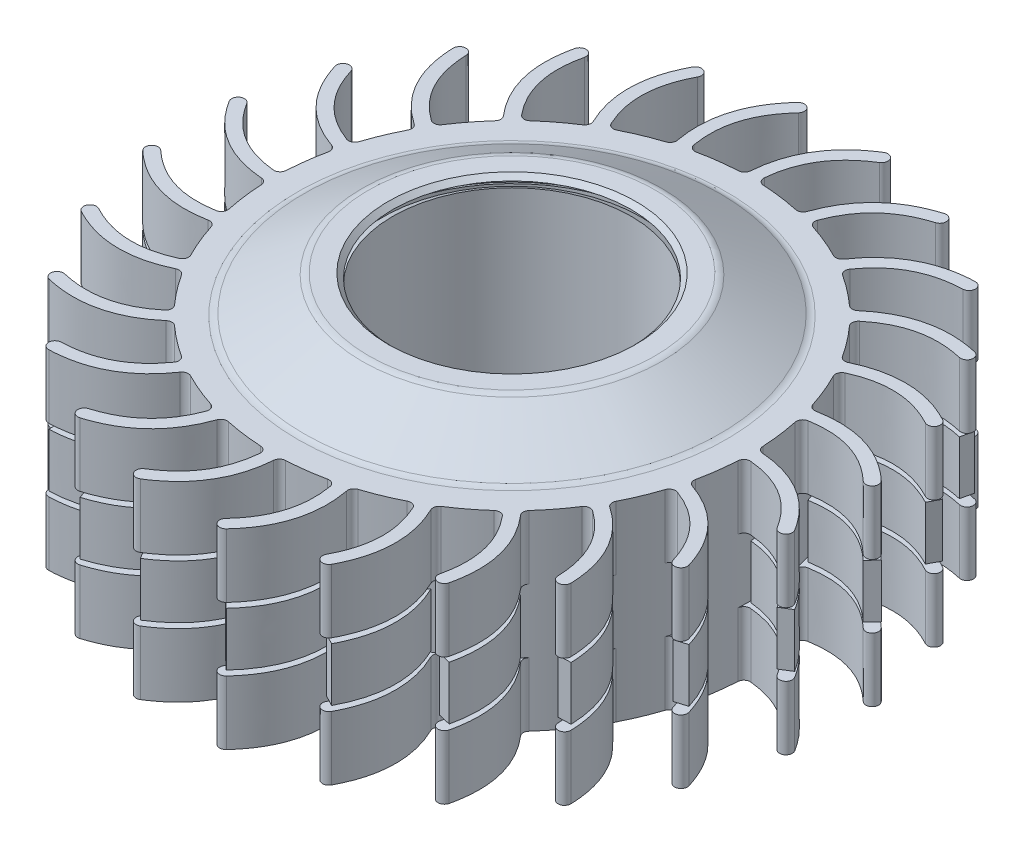
from build123d import *

# Parameters (mm, degrees)
SKETCH1_R                = 18.75
SKETCH1_R_2              = 13.75
BOSS_EXTRUDE1_DEPTH      = 15
BOSS_EXTRUDE2_DEPTH      = 5
FILLET1_R                = 0.5
FILLET2_DEPTH            = 5
CIRPATTERN1_COUNT        = 24
FILLET1_OF_CIRPATTERN1_R = 0.5
MIRROR1_START            = 10
MIRROR1_DEPTH            = 5
FILLET4_R                = 1
CHAMFER1_SIZE            = 1
CHAMFER1_SIZE_2          = 0.732050808
BOSS_EXTRUDE3_DEPTH      = 4.2
CIRPATTERN4_COUNT        = 24
BOSS_EXTRUDE4_REACH      = 42.713
SKETCH6_R                = 12.317160209
SKETCH6_R_2              = 11.517160209
SKETCH6_R_3              = 10.154712578
SKETCH6_R_4              = 9.354712578


with BuildPart() as part:
    # Sketch1 → Boss-Extrude1 (new body)
    with BuildSketch(Plane(origin=(0, 0, 0), x_dir=(1, 0, 0), z_dir=(0, 1, 0))):
        with Locations(Location((0, 0, 0), (0, 0, 270))):
            Circle(SKETCH1_R)
        with Locations(Location((0, 0, 0), (0, 0, 270))):
            Circle(SKETCH1_R_2, mode=Mode.SUBTRACT)
    extrude(amount=BOSS_EXTRUDE1_DEPTH)

    # Sketch2 → Boss-Extrude2 (add)
    with BuildSketch(Plane(origin=(0, 0, 0), x_dir=(1, 0, 0), z_dir=(0, 1, 0))):
        with BuildLine():
            ThreePointArc((18.75, 0), (18.74833243, -0.250062213), (18.743330015, -0.500079947))
            add(Edge.make_bspline(
                [(18.743330015, -0.500079947), (20.249175085, -0.554696371), (22.276517283, -1.391892892), (24.018730993, -2.731723154), (24.82083161, -4.014422972)],
                knots=[0.001258871, 0.001258871, 0.001258871, 0.375, 0.625, 1, 1, 1], degree=2))
            ThreePointArc((24.82083161, -4.014422972), (25.509613501, -4.174358919), (25.669549447, -3.485577028))
            add(Edge.make_bspline(
                [(18.766817552, 0.49971709), (20.440613064, 0.445794798), (22.781173245, -0.517803125), (24.785953616, -2.06298874), (25.669549447, -3.485577028)],
                knots=[0, 0, 0, 0.375, 0.625, 1, 1, 1], degree=2))
            Line((18.766817552, 0.49971709), (18.743339693, 0.49971709))
            ThreePointArc((18.743339693, 0.49971709), (18.748334849, 0.249880736), (18.75, 0))
        make_face()
    boss_extrude2 = extrude(amount=BOSS_EXTRUDE2_DEPTH)

    # Fillet1
    fillet1_edges = [part.edges().sort_by_distance(p)[0] for p in [
        (18.743330015, 2.5, 0.500079947),
    ]]
    fillet(fillet1_edges, radius=FILLET1_R)

    # Fillet2: read off the stored shape, not the designer's step
    # Fillet2 outline → Fillet2 (add)
    with BuildSketch(Plane(origin=(0, 0, 0), x_dir=(1, 0, 0), z_dir=(0, 1, 0))):
        with BuildLine():
            add(Edge.make_bspline(
                [(18.766817552, 0.49971709), (18.979861137, 0.492853767), (19.188539307, 0.47749748)],
                knots=[0, 0, 0, 0.047730648, 0.047730648, 0.047730648], degree=2))
            ThreePointArc((19.188539307, 0.47749748), (18.867686512, 0.626635767), (18.725877539, 0.950794618))
            ThreePointArc((18.725877539, 0.950794618), (18.735966154, 0.725308407), (18.743339693, 0.49971709))
            Line((18.743339693, 0.49971709), (18.766817552, 0.49971709))
        make_face()
    fillet2 = extrude(amount=FILLET2_DEPTH)

    # CirPattern1: Boss-Extrude2, Fillet2 ×24 about axis
    cirpattern1_axis = Axis((0, 15, 0), (0, 1, 0))
    add([boss_extrude2.rotate(cirpattern1_axis, i * 360 / CIRPATTERN1_COUNT) for i in range(1, CIRPATTERN1_COUNT)])
    add([fillet2.rotate(cirpattern1_axis, i * 360 / CIRPATTERN1_COUNT) for i in range(1, CIRPATTERN1_COUNT)])

    # Fillet1 of CirPattern1
    fillet1_of_cirpattern1_edges = [part.edges().sort_by_distance(p)[0] for p in [
        (18.234096746, 2.5, -4.368090641),
        (16.482239918, 2.5, -8.93858307),
        (13.607145677, 2.5, -12.899925834),
        (9.804746945, 2.5, -15.982159971),
        (5.334170912, 2.5, -17.975236318),
        (0.500079947, 2.5, -18.743330015),
        (-4.368090641, 2.5, -18.234096746),
        (-8.93858307, 2.5, -16.482239918),
        (-12.899925834, 2.5, -13.607145677),
        (-15.982159971, 2.5, -9.804746945),
        (-17.975236318, 2.5, -5.334170912),
        (-18.743330015, 2.5, -0.500079947),
        (-18.234096746, 2.5, 4.368090641),
        (-16.482239918, 2.5, 8.93858307),
        (-13.607145677, 2.5, 12.899925834),
        (-9.804746945, 2.5, 15.982159971),
        (-5.334170912, 2.5, 17.975236318),
        (-0.500079947, 2.5, 18.743330015),
        (4.368090641, 2.5, 18.234096746),
        (8.93858307, 2.5, 16.482239918),
        (12.899925834, 2.5, 13.607145677),
        (15.982159971, 2.5, 9.804746945),
        (17.975236318, 2.5, 5.334170912),
    ]]
    fillet(fillet1_of_cirpattern1_edges, radius=FILLET1_OF_CIRPATTERN1_R)

    # Mirror1: read off the stored shape, not the designer's step
    # Mirror1 outline → Mirror1 (add)
    with BuildSketch(Plane(origin=(0, 0, 0), x_dir=(1, 0, 0), z_dir=(0, 1, 0)).offset(MIRROR1_START)):
        with BuildLine():
            ThreePointArc((18.723067695, -1.004607436), (18.895412165, -0.653095529), (19.268186532, -0.533502434))
            add(Edge.make_bspline(
                [(19.268186532, -0.533502434), (20.464567735, -0.643643356), (22.276517283, -1.391892892), (24.018730993, -2.731723154), (24.82083161, -4.014422972)],
                knots=[0.067527533, 0.067527533, 0.067527533, 0.375, 0.625, 1, 1, 1], degree=2))
            ThreePointArc((24.82083161, -4.014422972), (25.509613501, -4.174358919), (25.669549447, -3.485577028))
            add(Edge.make_bspline(
                [(19.188539307, 0.47749748), (20.61935939, 0.372205753), (22.781173245, -0.517803125), (24.785953616, -2.06298874), (25.669549447, -3.485577028)],
                knots=[0.047730648, 0.047730648, 0.047730648, 0.375, 0.625, 1, 1, 1], degree=2))
            ThreePointArc((19.188539307, 0.47749748), (18.867686512, 0.626635767), (18.725877539, 0.950794618))
            ThreePointArc((18.725877539, 0.950794618), (18.749980642, -0.026943063), (18.723067695, -1.004607436))
        make_face()
        with BuildLine():
            ThreePointArc((18.658291127, -4.505132273), (18.386970955, -4.278032935), (18.33389249, -3.928216666))
            ThreePointArc((18.33389249, -3.928216666), (18.104117167, -4.878877086), (17.825083096, -5.81626277))
            ThreePointArc((17.825083096, -5.81626277), (18.082533046, -5.521334371), (18.473558406, -5.502297418))
            add(Edge.make_bspline(
                [(18.473558406, -5.502297418), (19.60066734, -5.91833162), (21.157214974, -7.110052223), (22.493290602, -8.855146965), (22.936073162, -10.301738762)],
                knots=[0.067527533, 0.067527533, 0.067527533, 0.375, 0.625, 1, 1, 1], degree=2))
            ThreePointArc((22.936073162, -10.301738762), (23.55999091, -10.634494895), (23.892747042, -10.010577147))
            add(Edge.make_bspline(
                [(18.658291127, -4.505132273), (20.013105694, -4.977159759), (21.87090628, -6.396360917), (23.407451951, -8.40777095), (23.892747042, -10.010577147)],
                knots=[0.047730648, 0.047730648, 0.047730648, 0.375, 0.625, 1, 1, 1], degree=2))
        make_face()
        with BuildLine():
            ThreePointArc((16.856511241, -9.180744706), (16.653213713, -8.891160762), (16.692482966, -8.539526476))
            ThreePointArc((16.692482966, -8.539526476), (16.224488025, -9.398323698), (15.712348542, -10.231549408))
            ThreePointArc((15.712348542, -10.231549408), (16.037359185, -10.013303401), (16.419987804, -10.096119927))
            add(Edge.make_bspline(
                [(16.419987804, -10.096119927), (17.401013857, -10.789695365), (18.596083429, -12.343673245), (19.434969629, -14.375107144), (19.488259231, -15.88700808)],
                knots=[0.067527533, 0.067527533, 0.067527533, 0.375, 0.625, 1, 1, 1], degree=2))
            ThreePointArc((19.488259231, -15.88700808), (20.004793873, -16.369907618), (20.487693411, -15.853372976))
            add(Edge.make_bspline(
                [(16.856511241, -9.180744706), (18.042991918, -9.987340058), (19.470173196, -11.839017283), (20.433771119, -14.179577464), (20.487693411, -15.853372976)],
                knots=[0.047730648, 0.047730648, 0.047730648, 0.375, 0.625, 1, 1, 1], degree=2))
        make_face()
        with BuildLine():
            ThreePointArc((17.841724979, 5.76501082), (18.118063922, 4.826827085), (18.345106171, 3.875510235))
            ThreePointArc((18.345106171, 3.875510235), (18.420600169, 4.259650695), (18.749719587, 4.47164986))
            add(Edge.make_bspline(
                [(18.749719587, 4.47164986), (19.933841658, 4.674908139), (21.877711753, 4.42112164), (23.907334559, 3.577863075), (25.014091402, 2.546469109)],
                knots=[0.067527533, 0.067527533, 0.067527533, 0.375, 0.625, 1, 1, 1], degree=2))
            ThreePointArc((25.014091402, 2.546469109), (25.720798088, 2.570252719), (25.697014478, 3.276959405))
            add(Edge.make_bspline(
                [(18.411120244, 5.427586568), (19.820437819, 5.696206057), (22.138940901, 5.396042094), (24.475333503, 4.422382744), (25.697014478, 3.276959405)],
                knots=[0.047730648, 0.047730648, 0.047730648, 0.375, 0.625, 1, 1, 1], degree=2))
            ThreePointArc((18.411120244, 5.427586568), (18.062600413, 5.488600278), (17.841724979, 5.76501082))
        make_face()
        with BuildLine():
            ThreePointArc((13.905987971, -13.230704559), (13.784567478, -12.898370677), (13.913508313, -12.568881669))
            ThreePointArc((13.913508313, -12.568881669), (13.239186836, -13.277290082), (12.528843401, -13.949572862))
            ThreePointArc((12.528843401, -13.949572862), (12.899265798, -13.822882352), (13.247422169, -14.001908547))
            add(Edge.make_bspline(
                [(13.247422169, -14.001908547), (14.015510037, -14.925759201), (14.76765953, -16.736093335), (15.052187594, -18.915427527), (14.71235264, -20.389604052)],
                knots=[0.067527533, 0.067527533, 0.067527533, 0.375, 0.625, 1, 1, 1], degree=2))
            ThreePointArc((14.71235264, -20.389604052), (15.086303193, -20.98973819), (15.686437331, -20.615787637))
            add(Edge.make_bspline(
                [(13.905987971, -13.230704559), (14.84327806, -14.316899637), (15.742579984, -16.474864186), (16.067562553, -18.985069208), (15.686437331, -20.615787637)],
                knots=[0.047730648, 0.047730648, 0.047730648, 0.375, 0.625, 1, 1, 1], degree=2))
        make_face()
        with BuildLine():
            ThreePointArc((15.741688348, 10.186351062), (16.251431088, 9.351656944), (16.716955978, 8.491518287))
            ThreePointArc((16.716955978, 8.491518287), (16.690454714, 8.882108763), (16.953490238, 9.172066605))
            add(Edge.make_bspline(
                [(16.953490238, 9.172066605), (18.044657214, 9.67487237), (19.987976321, 9.932844038), (22.166692783, 9.643623848), (23.502682203, 8.933823529)],
                knots=[0.067527533, 0.067527533, 0.067527533, 0.375, 0.625, 1, 1, 1], degree=2))
            ThreePointArc((23.502682203, 8.933823529), (24.179152792, 9.139705882), (23.973270439, 9.816176471))
            add(Edge.make_bspline(
                [(16.379013761, 10.007794601), (17.670786165, 10.632019332), (19.987976321, 10.942155962), (22.496759858, 10.606376152), (23.973270439, 9.816176471)],
                knots=[0.047730648, 0.047730648, 0.047730648, 0.375, 0.625, 1, 1, 1], degree=2))
            ThreePointArc((16.379013761, 10.007794601), (16.026577946, 9.976525749), (15.741688348, 10.186351062))
        make_face()
        with BuildLine():
            ThreePointArc((10.007794601, -16.379013761), (9.976525749, -16.026577946), (10.186351062, -15.741688348))
            ThreePointArc((10.186351062, -15.741688348), (9.351656944, -16.251431088), (8.491518287, -16.716955978))
            ThreePointArc((8.491518287, -16.716955978), (8.882108763, -16.690454714), (9.172066605, -16.953490238))
            add(Edge.make_bspline(
                [(9.172066605, -16.953490238), (9.67487237, -18.044657214), (9.932844038, -19.987976321), (9.643623848, -22.166692783), (8.933823529, -23.502682203)],
                knots=[0.067527533, 0.067527533, 0.067527533, 0.375, 0.625, 1, 1, 1], degree=2))
            ThreePointArc((8.933823529, -23.502682203), (9.139705882, -24.179152792), (9.816176471, -23.973270439))
            add(Edge.make_bspline(
                [(10.007794601, -16.379013761), (10.632019332, -17.670786165), (10.942155962, -19.987976321), (10.606376152, -22.496759858), (9.816176471, -23.973270439)],
                knots=[0.047730648, 0.047730648, 0.047730648, 0.375, 0.625, 1, 1, 1], degree=2))
        make_face()
        with BuildLine():
            ThreePointArc((12.568881669, 13.913508313), (13.277290082, 13.239186836), (13.949572862, 12.528843401))
            ThreePointArc((13.949572862, 12.528843401), (13.822882352, 12.899265798), (14.001908547, 13.247422169))
            add(Edge.make_bspline(
                [(14.001908547, 13.247422169), (14.925759201, 14.015510037), (16.736093335, 14.76765953), (18.915427527, 15.052187594), (20.389604052, 14.71235264)],
                knots=[0.067527533, 0.067527533, 0.067527533, 0.375, 0.625, 1, 1, 1], degree=2))
            ThreePointArc((20.389604052, 14.71235264), (20.98973819, 15.086303193), (20.615787637, 15.686437331))
            add(Edge.make_bspline(
                [(13.230704559, 13.905987971), (14.316899637, 14.84327806), (16.474864186, 15.742579984), (18.985069208, 16.067562553), (20.615787637, 15.686437331)],
                knots=[0.047730648, 0.047730648, 0.047730648, 0.375, 0.625, 1, 1, 1], degree=2))
            ThreePointArc((13.230704559, 13.905987971), (12.898370677, 13.784567478), (12.568881669, 13.913508313))
        make_face()
        with BuildLine():
            ThreePointArc((5.427586568, -18.411120244), (5.488600278, -18.062600413), (5.76501082, -17.841724979))
            ThreePointArc((5.76501082, -17.841724979), (4.826827085, -18.118063922), (3.875510235, -18.345106171))
            ThreePointArc((3.875510235, -18.345106171), (4.259650695, -18.420600169), (4.47164986, -18.749719587))
            add(Edge.make_bspline(
                [(4.47164986, -18.749719587), (4.674908139, -19.933841658), (4.42112164, -21.877711753), (3.577863075, -23.907334559), (2.546469109, -25.014091402)],
                knots=[0.067527533, 0.067527533, 0.067527533, 0.375, 0.625, 1, 1, 1], degree=2))
            ThreePointArc((2.546469109, -25.014091402), (2.570252719, -25.720798088), (3.276959405, -25.697014478))
            add(Edge.make_bspline(
                [(5.427586568, -18.411120244), (5.696206057, -19.820437819), (5.396042094, -22.138940901), (4.422382744, -24.475333503), (3.276959405, -25.697014478)],
                knots=[0.047730648, 0.047730648, 0.047730648, 0.375, 0.625, 1, 1, 1], degree=2))
        make_face()
        with BuildLine():
            ThreePointArc((8.539526476, 16.692482966), (9.398323698, 16.224488025), (10.231549408, 15.712348542))
            ThreePointArc((10.231549408, 15.712348542), (10.013303401, 16.037359185), (10.096119927, 16.419987804))
            add(Edge.make_bspline(
                [(10.096119927, 16.419987804), (10.789695365, 17.401013857), (12.343673245, 18.596083429), (14.375107144, 19.434969629), (15.88700808, 19.488259231)],
                knots=[0.067527533, 0.067527533, 0.067527533, 0.375, 0.625, 1, 1, 1], degree=2))
            ThreePointArc((15.88700808, 19.488259231), (16.369907618, 20.004793873), (15.853372976, 20.487693411))
            add(Edge.make_bspline(
                [(9.180744706, 16.856511241), (9.987340058, 18.042991918), (11.839017283, 19.470173196), (14.179577464, 20.433771119), (15.853372976, 20.487693411)],
                knots=[0.047730648, 0.047730648, 0.047730648, 0.375, 0.625, 1, 1, 1], degree=2))
            ThreePointArc((9.180744706, 16.856511241), (8.891160762, 16.653213713), (8.539526476, 16.692482966))
        make_face()
        with BuildLine():
            ThreePointArc((0.47749748, -19.188539307), (0.626635767, -18.867686512), (0.950794618, -18.725877539))
            ThreePointArc((0.950794618, -18.725877539), (-0.026943063, -18.749980642), (-1.004607436, -18.723067695))
            ThreePointArc((-1.004607436, -18.723067695), (-0.653095529, -18.895412165), (-0.533502434, -19.268186532))
            add(Edge.make_bspline(
                [(-0.533502434, -19.268186532), (-0.643643356, -20.464567735), (-1.391892892, -22.276517283), (-2.731723154, -24.018730993), (-4.014422972, -24.82083161)],
                knots=[0.067527533, 0.067527533, 0.067527533, 0.375, 0.625, 1, 1, 1], degree=2))
            ThreePointArc((-4.014422972, -24.82083161), (-4.174358919, -25.509613501), (-3.485577028, -25.669549447))
            add(Edge.make_bspline(
                [(0.47749748, -19.188539307), (0.372205753, -20.61935939), (-0.517803125, -22.781173245), (-2.06298874, -24.785953616), (-3.485577028, -25.669549447)],
                knots=[0.047730648, 0.047730648, 0.047730648, 0.375, 0.625, 1, 1, 1], degree=2))
        make_face()
        with BuildLine():
            ThreePointArc((3.928216666, 18.33389249), (4.878877086, 18.104117167), (5.81626277, 17.825083096))
            ThreePointArc((5.81626277, 17.825083096), (5.521334371, 18.082533046), (5.502297418, 18.473558406))
            add(Edge.make_bspline(
                [(5.502297418, 18.473558406), (5.91833162, 19.60066734), (7.110052223, 21.157214974), (8.855146965, 22.493290602), (10.301738762, 22.936073162)],
                knots=[0.067527533, 0.067527533, 0.067527533, 0.375, 0.625, 1, 1, 1], degree=2))
            ThreePointArc((10.301738762, 22.936073162), (10.634494895, 23.55999091), (10.010577147, 23.892747042))
            add(Edge.make_bspline(
                [(4.505132273, 18.658291127), (4.977159759, 20.013105694), (6.396360917, 21.87090628), (8.40777095, 23.407451951), (10.010577147, 23.892747042)],
                knots=[0.047730648, 0.047730648, 0.047730648, 0.375, 0.625, 1, 1, 1], degree=2))
            ThreePointArc((4.505132273, 18.658291127), (4.278032935, 18.386970955), (3.928216666, 18.33389249))
        make_face()
        with BuildLine():
            ThreePointArc((-4.505132273, -18.658291127), (-4.278032935, -18.386970955), (-3.928216666, -18.33389249))
            ThreePointArc((-3.928216666, -18.33389249), (-4.878877086, -18.104117167), (-5.81626277, -17.825083096))
            ThreePointArc((-5.81626277, -17.825083096), (-5.521334371, -18.082533046), (-5.502297418, -18.473558406))
            add(Edge.make_bspline(
                [(-5.502297418, -18.473558406), (-5.91833162, -19.60066734), (-7.110052223, -21.157214974), (-8.855146965, -22.493290602), (-10.301738762, -22.936073162)],
                knots=[0.067527533, 0.067527533, 0.067527533, 0.375, 0.625, 1, 1, 1], degree=2))
            ThreePointArc((-10.301738762, -22.936073162), (-10.634494895, -23.55999091), (-10.010577147, -23.892747042))
            add(Edge.make_bspline(
                [(-4.505132273, -18.658291127), (-4.977159759, -20.013105694), (-6.396360917, -21.87090628), (-8.40777095, -23.407451951), (-10.010577147, -23.892747042)],
                knots=[0.047730648, 0.047730648, 0.047730648, 0.375, 0.625, 1, 1, 1], degree=2))
        make_face()
        with BuildLine():
            ThreePointArc((-0.950794618, 18.725877539), (0.026943063, 18.749980642), (1.004607436, 18.723067695))
            ThreePointArc((1.004607436, 18.723067695), (0.653095529, 18.895412165), (0.533502434, 19.268186532))
            add(Edge.make_bspline(
                [(0.533502434, 19.268186532), (0.643643356, 20.464567735), (1.391892892, 22.276517283), (2.731723154, 24.018730993), (4.014422972, 24.82083161)],
                knots=[0.067527533, 0.067527533, 0.067527533, 0.375, 0.625, 1, 1, 1], degree=2))
            ThreePointArc((4.014422972, 24.82083161), (4.174358919, 25.509613501), (3.485577028, 25.669549447))
            add(Edge.make_bspline(
                [(-0.47749748, 19.188539307), (-0.372205753, 20.61935939), (0.517803125, 22.781173245), (2.06298874, 24.785953616), (3.485577028, 25.669549447)],
                knots=[0.047730648, 0.047730648, 0.047730648, 0.375, 0.625, 1, 1, 1], degree=2))
            ThreePointArc((-0.47749748, 19.188539307), (-0.626635767, 18.867686512), (-0.950794618, 18.725877539))
        make_face()
        with BuildLine():
            ThreePointArc((-9.180744706, -16.856511241), (-8.891160762, -16.653213713), (-8.539526476, -16.692482966))
            ThreePointArc((-8.539526476, -16.692482966), (-9.398323698, -16.224488025), (-10.231549408, -15.712348542))
            ThreePointArc((-10.231549408, -15.712348542), (-10.013303401, -16.037359185), (-10.096119927, -16.419987804))
            add(Edge.make_bspline(
                [(-10.096119927, -16.419987804), (-10.789695365, -17.401013857), (-12.343673245, -18.596083429), (-14.375107144, -19.434969629), (-15.88700808, -19.488259231)],
                knots=[0.067527533, 0.067527533, 0.067527533, 0.375, 0.625, 1, 1, 1], degree=2))
            ThreePointArc((-15.88700808, -19.488259231), (-16.369907618, -20.004793873), (-15.853372976, -20.487693411))
            add(Edge.make_bspline(
                [(-9.180744706, -16.856511241), (-9.987340058, -18.042991918), (-11.839017283, -19.470173196), (-14.179577464, -20.433771119), (-15.853372976, -20.487693411)],
                knots=[0.047730648, 0.047730648, 0.047730648, 0.375, 0.625, 1, 1, 1], degree=2))
        make_face()
        with BuildLine():
            ThreePointArc((-5.76501082, 17.841724979), (-4.826827085, 18.118063922), (-3.875510235, 18.345106171))
            ThreePointArc((-3.875510235, 18.345106171), (-4.259650695, 18.420600169), (-4.47164986, 18.749719587))
            add(Edge.make_bspline(
                [(-4.47164986, 18.749719587), (-4.674908139, 19.933841658), (-4.42112164, 21.877711753), (-3.577863075, 23.907334559), (-2.546469109, 25.014091402)],
                knots=[0.067527533, 0.067527533, 0.067527533, 0.375, 0.625, 1, 1, 1], degree=2))
            ThreePointArc((-2.546469109, 25.014091402), (-2.570252719, 25.720798088), (-3.276959405, 25.697014478))
            add(Edge.make_bspline(
                [(-5.427586568, 18.411120244), (-5.696206057, 19.820437819), (-5.396042094, 22.138940901), (-4.422382744, 24.475333503), (-3.276959405, 25.697014478)],
                knots=[0.047730648, 0.047730648, 0.047730648, 0.375, 0.625, 1, 1, 1], degree=2))
            ThreePointArc((-5.427586568, 18.411120244), (-5.488600278, 18.062600413), (-5.76501082, 17.841724979))
        make_face()
        with BuildLine():
            ThreePointArc((-13.230704559, -13.905987971), (-12.898370677, -13.784567478), (-12.568881669, -13.913508313))
            ThreePointArc((-12.568881669, -13.913508313), (-13.277290082, -13.239186836), (-13.949572862, -12.528843401))
            ThreePointArc((-13.949572862, -12.528843401), (-13.822882352, -12.899265798), (-14.001908547, -13.247422169))
            add(Edge.make_bspline(
                [(-14.001908547, -13.247422169), (-14.925759201, -14.015510037), (-16.736093335, -14.76765953), (-18.915427527, -15.052187594), (-20.389604052, -14.71235264)],
                knots=[0.067527533, 0.067527533, 0.067527533, 0.375, 0.625, 1, 1, 1], degree=2))
            ThreePointArc((-20.389604052, -14.71235264), (-20.98973819, -15.086303193), (-20.615787637, -15.686437331))
            add(Edge.make_bspline(
                [(-13.230704559, -13.905987971), (-14.316899637, -14.84327806), (-16.474864186, -15.742579984), (-18.985069208, -16.067562553), (-20.615787637, -15.686437331)],
                knots=[0.047730648, 0.047730648, 0.047730648, 0.375, 0.625, 1, 1, 1], degree=2))
        make_face()
        with BuildLine():
            ThreePointArc((-10.186351062, 15.741688348), (-9.351656944, 16.251431088), (-8.491518287, 16.716955978))
            ThreePointArc((-8.491518287, 16.716955978), (-8.882108763, 16.690454714), (-9.172066605, 16.953490238))
            add(Edge.make_bspline(
                [(-9.172066605, 16.953490238), (-9.67487237, 18.044657214), (-9.932844038, 19.987976321), (-9.643623848, 22.166692783), (-8.933823529, 23.502682203)],
                knots=[0.067527533, 0.067527533, 0.067527533, 0.375, 0.625, 1, 1, 1], degree=2))
            ThreePointArc((-8.933823529, 23.502682203), (-9.139705882, 24.179152792), (-9.816176471, 23.973270439))
            add(Edge.make_bspline(
                [(-10.007794601, 16.379013761), (-10.632019332, 17.670786165), (-10.942155962, 19.987976321), (-10.606376152, 22.496759858), (-9.816176471, 23.973270439)],
                knots=[0.047730648, 0.047730648, 0.047730648, 0.375, 0.625, 1, 1, 1], degree=2))
            ThreePointArc((-10.007794601, 16.379013761), (-9.976525749, 16.026577946), (-10.186351062, 15.741688348))
        make_face()
        with BuildLine():
            ThreePointArc((-16.379013761, -10.007794601), (-16.026577946, -9.976525749), (-15.741688348, -10.186351062))
            ThreePointArc((-15.741688348, -10.186351062), (-16.251431088, -9.351656944), (-16.716955978, -8.491518287))
            ThreePointArc((-16.716955978, -8.491518287), (-16.690454714, -8.882108763), (-16.953490238, -9.172066605))
            add(Edge.make_bspline(
                [(-16.953490238, -9.172066605), (-18.044657214, -9.67487237), (-19.987976321, -9.932844038), (-22.166692783, -9.643623848), (-23.502682203, -8.933823529)],
                knots=[0.067527533, 0.067527533, 0.067527533, 0.375, 0.625, 1, 1, 1], degree=2))
            ThreePointArc((-23.502682203, -8.933823529), (-24.179152792, -9.139705882), (-23.973270439, -9.816176471))
            add(Edge.make_bspline(
                [(-16.379013761, -10.007794601), (-17.670786165, -10.632019332), (-19.987976321, -10.942155962), (-22.496759858, -10.606376152), (-23.973270439, -9.816176471)],
                knots=[0.047730648, 0.047730648, 0.047730648, 0.375, 0.625, 1, 1, 1], degree=2))
        make_face()
        with BuildLine():
            ThreePointArc((-13.913508313, 12.568881669), (-13.239186836, 13.277290082), (-12.528843401, 13.949572862))
            ThreePointArc((-12.528843401, 13.949572862), (-12.899265798, 13.822882352), (-13.247422169, 14.001908547))
            add(Edge.make_bspline(
                [(-13.247422169, 14.001908547), (-14.015510037, 14.925759201), (-14.76765953, 16.736093335), (-15.052187594, 18.915427527), (-14.71235264, 20.389604052)],
                knots=[0.067527533, 0.067527533, 0.067527533, 0.375, 0.625, 1, 1, 1], degree=2))
            ThreePointArc((-14.71235264, 20.389604052), (-15.086303193, 20.98973819), (-15.686437331, 20.615787637))
            add(Edge.make_bspline(
                [(-13.905987971, 13.230704559), (-14.84327806, 14.316899637), (-15.742579984, 16.474864186), (-16.067562553, 18.985069208), (-15.686437331, 20.615787637)],
                knots=[0.047730648, 0.047730648, 0.047730648, 0.375, 0.625, 1, 1, 1], degree=2))
            ThreePointArc((-13.905987971, 13.230704559), (-13.784567478, 12.898370677), (-13.913508313, 12.568881669))
        make_face()
        with BuildLine():
            ThreePointArc((-18.411120244, -5.427586568), (-18.062600413, -5.488600278), (-17.841724979, -5.76501082))
            ThreePointArc((-17.841724979, -5.76501082), (-18.118063922, -4.826827085), (-18.345106171, -3.875510235))
            ThreePointArc((-18.345106171, -3.875510235), (-18.420600169, -4.259650695), (-18.749719587, -4.47164986))
            add(Edge.make_bspline(
                [(-18.749719587, -4.47164986), (-19.933841658, -4.674908139), (-21.877711753, -4.42112164), (-23.907334559, -3.577863075), (-25.014091402, -2.546469109)],
                knots=[0.067527533, 0.067527533, 0.067527533, 0.375, 0.625, 1, 1, 1], degree=2))
            ThreePointArc((-25.014091402, -2.546469109), (-25.720798088, -2.570252719), (-25.697014478, -3.276959405))
            add(Edge.make_bspline(
                [(-18.411120244, -5.427586568), (-19.820437819, -5.696206057), (-22.138940901, -5.396042094), (-24.475333503, -4.422382744), (-25.697014478, -3.276959405)],
                knots=[0.047730648, 0.047730648, 0.047730648, 0.375, 0.625, 1, 1, 1], degree=2))
        make_face()
        with BuildLine():
            ThreePointArc((-16.692482966, 8.539526476), (-16.224488025, 9.398323698), (-15.712348542, 10.231549408))
            ThreePointArc((-15.712348542, 10.231549408), (-16.037359185, 10.013303401), (-16.419987804, 10.096119927))
            add(Edge.make_bspline(
                [(-16.419987804, 10.096119927), (-17.401013857, 10.789695365), (-18.596083429, 12.343673245), (-19.434969629, 14.375107144), (-19.488259231, 15.88700808)],
                knots=[0.067527533, 0.067527533, 0.067527533, 0.375, 0.625, 1, 1, 1], degree=2))
            ThreePointArc((-19.488259231, 15.88700808), (-20.004793873, 16.369907618), (-20.487693411, 15.853372976))
            add(Edge.make_bspline(
                [(-16.856511241, 9.180744706), (-18.042991918, 9.987340058), (-19.470173196, 11.839017283), (-20.433771119, 14.179577464), (-20.487693411, 15.853372976)],
                knots=[0.047730648, 0.047730648, 0.047730648, 0.375, 0.625, 1, 1, 1], degree=2))
            ThreePointArc((-16.856511241, 9.180744706), (-16.653213713, 8.891160762), (-16.692482966, 8.539526476))
        make_face()
        with BuildLine():
            ThreePointArc((-19.188539307, -0.47749748), (-18.867686512, -0.626635767), (-18.725877539, -0.950794618))
            ThreePointArc((-18.725877539, -0.950794618), (-18.749980642, 0.026943063), (-18.723067695, 1.004607436))
            ThreePointArc((-18.723067695, 1.004607436), (-18.895412165, 0.653095529), (-19.268186532, 0.533502434))
            add(Edge.make_bspline(
                [(-19.268186532, 0.533502434), (-20.464567735, 0.643643356), (-22.276517283, 1.391892892), (-24.018730993, 2.731723154), (-24.82083161, 4.014422972)],
                knots=[0.067527533, 0.067527533, 0.067527533, 0.375, 0.625, 1, 1, 1], degree=2))
            ThreePointArc((-24.82083161, 4.014422972), (-25.509613501, 4.174358919), (-25.669549447, 3.485577028))
            add(Edge.make_bspline(
                [(-19.188539307, -0.47749748), (-20.61935939, -0.372205753), (-22.781173245, 0.517803125), (-24.785953616, 2.06298874), (-25.669549447, 3.485577028)],
                knots=[0.047730648, 0.047730648, 0.047730648, 0.375, 0.625, 1, 1, 1], degree=2))
        make_face()
        with BuildLine():
            ThreePointArc((-18.33389249, 3.928216666), (-18.104117167, 4.878877086), (-17.825083096, 5.81626277))
            ThreePointArc((-17.825083096, 5.81626277), (-18.082533046, 5.521334371), (-18.473558406, 5.502297418))
            add(Edge.make_bspline(
                [(-18.473558406, 5.502297418), (-19.60066734, 5.91833162), (-21.157214974, 7.110052223), (-22.493290602, 8.855146965), (-22.936073162, 10.301738762)],
                knots=[0.067527533, 0.067527533, 0.067527533, 0.375, 0.625, 1, 1, 1], degree=2))
            ThreePointArc((-22.936073162, 10.301738762), (-23.55999091, 10.634494895), (-23.892747042, 10.010577147))
            add(Edge.make_bspline(
                [(-18.658291127, 4.505132273), (-20.013105694, 4.977159759), (-21.87090628, 6.396360917), (-23.407451951, 8.40777095), (-23.892747042, 10.010577147)],
                knots=[0.047730648, 0.047730648, 0.047730648, 0.375, 0.625, 1, 1, 1], degree=2))
            ThreePointArc((-18.658291127, 4.505132273), (-18.386970955, 4.278032935), (-18.33389249, 3.928216666))
        make_face()
    extrude(amount=MIRROR1_DEPTH)

    # Sketch3 → Revolve1 (revolve)
    with BuildSketch(Plane(origin=(0, 0, 0), x_dir=(0, 0, -1), z_dir=(1, 0, 0))):
        Polygon((-13.75, 15), (-8.720737982, 17.90364578), (-11.525384879, 17.90364578), (-16.554646897, 15), align=None)
    revolve(axis=Axis((0, 18.651226741, 0), (0, -1, 0)))

    # Fillet4
    fillet4_edges = [part.edges().sort_by_distance(p)[0] for p in [
        (0, 15, -16.554646897),
        (0, 15, -13.75),
        (0, 17.90364578, -11.525384879),
    ]]
    fillet(fillet4_edges, radius=FILLET4_R)

    # Chamfer1
    # the kernel refuses this chamfer: 1, 0.732050808 mm, written as the material it takes off along each edge
    with BuildSketch(Plane(origin=(0, 17.90364578, 0), x_dir=(0, 0, 1), z_dir=(1, 0, 0))) as chamfer1_piece_1:
        Polygon((8.720737982 + CHAMFER1_SIZE, 0), (8.720737982 + CHAMFER1_SIZE_2 * 0.866025403274, CHAMFER1_SIZE_2 * 0.499999999706), (8.720737982, 0), align=None)
    revolve(axis=Axis((0, 17.90364578, 0), (0, -1, 0)), mode=Mode.SUBTRACT)


with BuildPart() as body_2:
    # Sketch5 → Boss-Extrude3 (new body)
    with BuildSketch(Plane(origin=(0, 5.4, 0), x_dir=(1, 0, 0), z_dir=(0, 1, 0))):
        with BuildLine():
            Line((18.411120244, 5.427586568), (18.749719587, 4.47164986))
            add(Edge.make_bspline(
                [(18.749719587, 4.47164986), (19.933841658, 4.674908139), (21.877711753, 4.42112164), (23.907334559, 3.577863075), (25.014091402, 2.546469109)],
                knots=[0.067527533, 0.067527533, 0.067527533, 0.375, 0.625, 1, 1, 1], degree=2))
            Line((25.014091402, 2.546469109), (25.697014478, 3.276959405))
            add(Edge.make_bspline(
                [(18.411120244, 5.427586568), (19.820437819, 5.696206057), (22.138940901, 5.396042094), (24.475333503, 4.422382744), (25.697014478, 3.276959405)],
                knots=[0.047730648, 0.047730648, 0.047730648, 0.375, 0.625, 1, 1, 1], degree=2))
        make_face()
    extrude(amount=BOSS_EXTRUDE3_DEPTH)


with BuildPart() as cirpattern4_1:
    # CirPattern4: pattern copy
    add(body_2.part.rotate(Axis((0, 0, 0), (0, -1, 0)), 1 * 360 / CIRPATTERN4_COUNT))


with BuildPart() as cirpattern4_2:
    # CirPattern4: pattern copy
    add(body_2.part.rotate(Axis((0, 0, 0), (0, -1, 0)), 2 * 360 / CIRPATTERN4_COUNT))


with BuildPart() as cirpattern4_3:
    # CirPattern4: pattern copy
    add(body_2.part.rotate(Axis((0, 0, 0), (0, -1, 0)), 3 * 360 / CIRPATTERN4_COUNT))


with BuildPart() as cirpattern4_4:
    # CirPattern4: pattern copy
    add(body_2.part.rotate(Axis((0, 0, 0), (0, -1, 0)), 4 * 360 / CIRPATTERN4_COUNT))


with BuildPart() as cirpattern4_5:
    # CirPattern4: pattern copy
    add(body_2.part.rotate(Axis((0, 0, 0), (0, -1, 0)), 5 * 360 / CIRPATTERN4_COUNT))


with BuildPart() as cirpattern4_6:
    # CirPattern4: pattern copy
    add(body_2.part.rotate(Axis((0, 0, 0), (0, -1, 0)), 6 * 360 / CIRPATTERN4_COUNT))


with BuildPart() as cirpattern4_7:
    # CirPattern4: pattern copy
    add(body_2.part.rotate(Axis((0, 0, 0), (0, -1, 0)), 7 * 360 / CIRPATTERN4_COUNT))


with BuildPart() as cirpattern4_8:
    # CirPattern4: pattern copy
    add(body_2.part.rotate(Axis((0, 0, 0), (0, -1, 0)), 8 * 360 / CIRPATTERN4_COUNT))


with BuildPart() as cirpattern4_9:
    # CirPattern4: pattern copy
    add(body_2.part.rotate(Axis((0, 0, 0), (0, -1, 0)), 9 * 360 / CIRPATTERN4_COUNT))


with BuildPart() as cirpattern4_10:
    # CirPattern4: pattern copy
    add(body_2.part.rotate(Axis((0, 0, 0), (0, -1, 0)), 10 * 360 / CIRPATTERN4_COUNT))


with BuildPart() as cirpattern4_11:
    # CirPattern4: pattern copy
    add(body_2.part.rotate(Axis((0, 0, 0), (0, -1, 0)), 11 * 360 / CIRPATTERN4_COUNT))


with BuildPart() as cirpattern4_12:
    # CirPattern4: pattern copy
    add(body_2.part.rotate(Axis((0, 0, 0), (0, -1, 0)), 12 * 360 / CIRPATTERN4_COUNT))


with BuildPart() as cirpattern4_13:
    # CirPattern4: pattern copy
    add(body_2.part.rotate(Axis((0, 0, 0), (0, -1, 0)), 13 * 360 / CIRPATTERN4_COUNT))


with BuildPart() as cirpattern4_14:
    # CirPattern4: pattern copy
    add(body_2.part.rotate(Axis((0, 0, 0), (0, -1, 0)), 14 * 360 / CIRPATTERN4_COUNT))


with BuildPart() as cirpattern4_15:
    # CirPattern4: pattern copy
    add(body_2.part.rotate(Axis((0, 0, 0), (0, -1, 0)), 15 * 360 / CIRPATTERN4_COUNT))


with BuildPart() as cirpattern4_16:
    # CirPattern4: pattern copy
    add(body_2.part.rotate(Axis((0, 0, 0), (0, -1, 0)), 16 * 360 / CIRPATTERN4_COUNT))


with BuildPart() as cirpattern4_17:
    # CirPattern4: pattern copy
    add(body_2.part.rotate(Axis((0, 0, 0), (0, -1, 0)), 17 * 360 / CIRPATTERN4_COUNT))


with BuildPart() as cirpattern4_18:
    # CirPattern4: pattern copy
    add(body_2.part.rotate(Axis((0, 0, 0), (0, -1, 0)), 18 * 360 / CIRPATTERN4_COUNT))


with BuildPart() as cirpattern4_19:
    # CirPattern4: pattern copy
    add(body_2.part.rotate(Axis((0, 0, 0), (0, -1, 0)), 19 * 360 / CIRPATTERN4_COUNT))


with BuildPart() as cirpattern4_20:
    # CirPattern4: pattern copy
    add(body_2.part.rotate(Axis((0, 0, 0), (0, -1, 0)), 20 * 360 / CIRPATTERN4_COUNT))


with BuildPart() as cirpattern4_21:
    # CirPattern4: pattern copy
    add(body_2.part.rotate(Axis((0, 0, 0), (0, -1, 0)), 21 * 360 / CIRPATTERN4_COUNT))


with BuildPart() as cirpattern4_22:
    # CirPattern4: pattern copy
    add(body_2.part.rotate(Axis((0, 0, 0), (0, -1, 0)), 22 * 360 / CIRPATTERN4_COUNT))


with BuildPart() as cirpattern4_23:
    # CirPattern4: pattern copy
    add(body_2.part.rotate(Axis((0, 0, 0), (0, -1, 0)), 23 * 360 / CIRPATTERN4_COUNT))


with BuildPart() as body_26:
    # Boss-Extrude4: up to this cone (the profile starts inside it)
    boss_extrude4_end = Plane(origin=(0, 0, 0), z_dir=(0, -1, 0)).offset(-22.476684986) * Cone(1.732e-06, 181.207931619, 104.6204471, align=(Align.CENTER, Align.CENTER, Align.MIN), mode=Mode.PRIVATE)
    # Sketch6 → Boss-Extrude4 (new, up to the surface)
    with BuildSketch(Plane(origin=(0, 0, 0), x_dir=(1, 0, 0), z_dir=(0, 1, 0)), mode=Mode.PRIVATE) as boss_extrude4_sk1:
        with Locations(Location((0, 0, 0), (0, 0, 90))):
            Circle(SKETCH6_R)
        with Locations(Location((0, 0, 0), (0, 0, 90))):
            Circle(SKETCH6_R_2, mode=Mode.SUBTRACT)
    boss_extrude4_tool1 = extrude(boss_extrude4_sk1.sketch, amount=BOSS_EXTRUDE4_REACH, mode=Mode.PRIVATE) & boss_extrude4_end
    add(boss_extrude4_tool1.solids().sort_by_distance((0, 0, 11.968778))[0])
    # Sketch6 → Boss-Extrude4 (new, up to the surface)
    with BuildSketch(Plane(origin=(0, 0, 0), x_dir=(1, 0, 0), z_dir=(0, 1, 0)), mode=Mode.PRIVATE) as boss_extrude4_sk2:
        with Locations(Location((0, 0, 0), (0, 0, 90))):
            Circle(SKETCH6_R_3)
        with Locations(Location((0, 0, 0), (0, 0, 90))):
            Circle(SKETCH6_R_4, mode=Mode.SUBTRACT)
    boss_extrude4_tool2 = extrude(boss_extrude4_sk2.sketch, amount=BOSS_EXTRUDE4_REACH, mode=Mode.PRIVATE) & boss_extrude4_end
    add(boss_extrude4_tool2.solids().sort_by_distance((0, 0, 9.867494))[0])


solid = Compound([part.part, body_2.part, cirpattern4_1.part, cirpattern4_2.part, cirpattern4_3.part, cirpattern4_4.part, cirpattern4_5.part, cirpattern4_6.part, cirpattern4_7.part, cirpattern4_8.part, cirpattern4_9.part, cirpattern4_10.part, cirpattern4_11.part, cirpattern4_12.part, cirpattern4_13.part, cirpattern4_14.part, cirpattern4_15.part, cirpattern4_16.part, cirpattern4_17.part, cirpattern4_18.part, cirpattern4_19.part, cirpattern4_20.part, cirpattern4_21.part, cirpattern4_22.part, cirpattern4_23.part, body_26.part])
